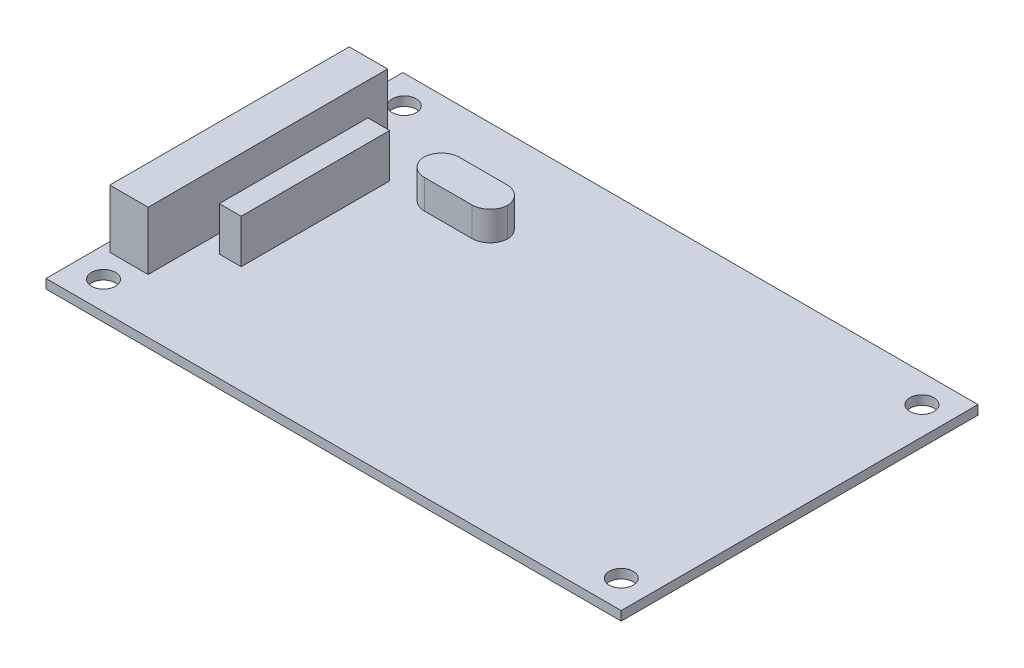
from build123d import *

# Parameters (mm, degrees)
SKETCH1_W           = 79
SKETCH1_H           = 49
BOSS_EXTRUDE1_DEPTH = 1.26
SKETCH2_R           = 1.65
CUT_EXTRUDE1_DEPTH  = 1.26
SKETCH3_W           = 5.27
SKETCH3_H           = 32.88
BOSS_EXTRUDE2_DEPTH = 8
SKETCH4_W           = 3
SKETCH4_H           = 20.4
BOSS_EXTRUDE3_DEPTH = 6
SKETCH5_W           = 11.5
SKETCH5_H           = 4.8
BOSS_EXTRUDE4_DEPTH = 4
FILLET1_R           = 2.5


with BuildPart() as part:
    # Sketch1 → Boss-Extrude1 (new body)
    with BuildSketch(Plane(origin=(0, 0, 0), x_dir=(1, 0, 0), z_dir=(0, 1, 0))):
        with Locations((-2.076516426, -7.930241605)):
            Rectangle(SKETCH1_W, SKETCH1_H)
    extrude(amount=BOSS_EXTRUDE1_DEPTH)

    # Sketch2 → Cut-Extrude1 (cut)
    with BuildSketch(Plane(origin=(0, 1.26, 0), x_dir=(1, 0, 0), z_dir=(0, 1, 0))):
        with Locations(Location((33.573483574, 12.719758395, 0), (0, 0, 270))):
            Circle(SKETCH2_R)
        with Locations(Location((33.573483574, -28.580241605, 0), (0, 0, 270))):
            Circle(SKETCH2_R)
        with Locations(Location((-37.526516426, -28.580241605, 0), (0, 0, 270))):
            Circle(SKETCH2_R)
        with Locations(Location((-37.526516426, 12.719758395, 0), (0, 0, 270))):
            Circle(SKETCH2_R)
    extrude(amount=-CUT_EXTRUDE1_DEPTH, mode=Mode.SUBTRACT)

    # Sketch3 → Boss-Extrude2 (add)
    with BuildSketch(Plane(origin=(0, 1.26, 0), x_dir=(1, 0, 0), z_dir=(0, 1, 0))):
        with Locations((-37.671516426, -8.500241605)):
            Rectangle(SKETCH3_W, SKETCH3_H)
    extrude(amount=BOSS_EXTRUDE2_DEPTH)

    # Sketch4 → Boss-Extrude3 (add)
    with BuildSketch(Plane(origin=(0, 1.26, 0), x_dir=(1, 0, 0), z_dir=(0, 1, 0))):
        with Locations((-31.076516426, -7.430241605)):
            Rectangle(SKETCH4_W, SKETCH4_H)
    extrude(amount=BOSS_EXTRUDE3_DEPTH)

    # Sketch5 → Boss-Extrude4 (add)
    with BuildSketch(Plane(origin=(0, 1.26, 0), x_dir=(1, 0, 0), z_dir=(0, 1, 0))):
        with Locations((-20.326516426, 3.969758395)):
            Rectangle(SKETCH5_W, SKETCH5_H)
    extrude(amount=BOSS_EXTRUDE4_DEPTH)

    # Fillet1
    # the kernel refuses this fillet: 2.5 mm, written as the material it takes off along each edge
    with BuildSketch(Plane(origin=(-26.076516426, 1.26, -6.369758395), x_dir=(0, 0, 1), z_dir=(0, 1, 0)), Plane(origin=(-26.076516426, 1.26, -1.569758395), x_dir=(1, 0, 0), z_dir=(0, 1, 0)), Plane(origin=(-14.576516426, 1.26, -1.569758395), x_dir=(0, 0, -1), z_dir=(0, 1, 0))) as fillet1_piece_1:
        with BuildLine():
            CenterArc((FILLET1_R, FILLET1_R), FILLET1_R, 180, 90)
            Line((0, FILLET1_R), (0, 0))
            Line((0, 0), (FILLET1_R, 0))
        make_face()
    extrude(amount=10.25, mode=Mode.SUBTRACT)
    with BuildSketch(Plane(origin=(-14.576516426, 1.26, -6.369758395), x_dir=(0, 0, 1), z_dir=(0, 1, 0))) as fillet1_piece_2:
        with BuildLine():
            CenterArc((FILLET1_R, -FILLET1_R), FILLET1_R, 90, 90)
            Line((0, -FILLET1_R), (0, 0))
            Line((0, 0), (FILLET1_R, 0))
        make_face()
    extrude(amount=10.25, mode=Mode.SUBTRACT)


solid = part.part
